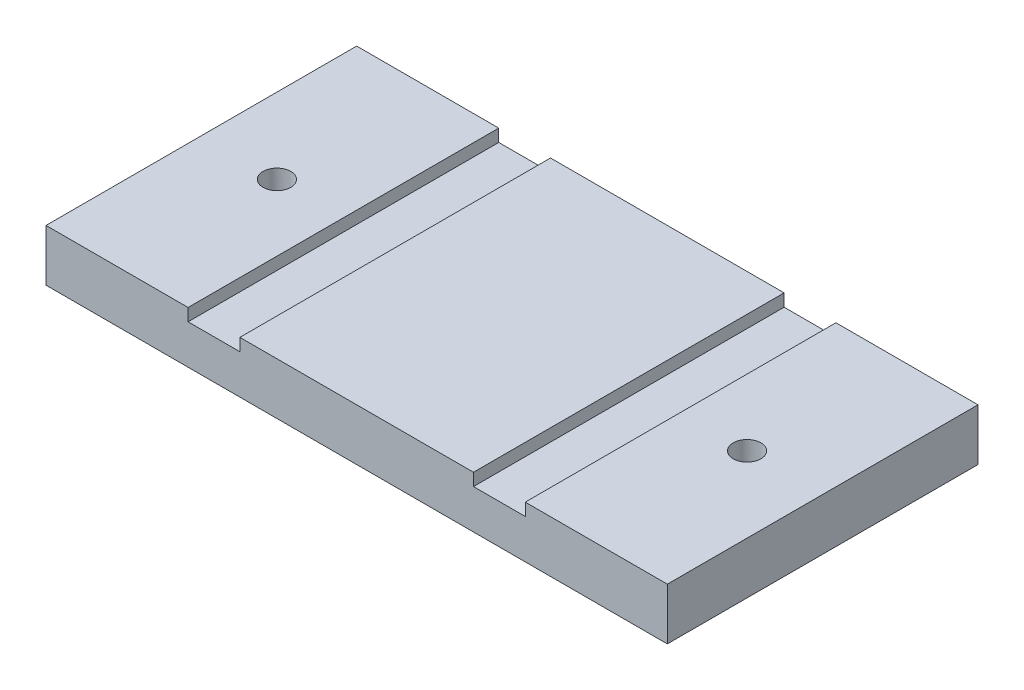
from build123d import *

# Parameters (mm, degrees)
SKETCH1_W            = 76.2
SKETCH1_H            = 38.1
BOSS_EXTRUDE1_DEPTH  = 6.35
M3_CLEARANCE_HOLE1_D = 3.4
SKETCH5_W            = 6.35
SKETCH5_H            = 1.524
CUT_EXTRUDE1_DEPTH   = 86.430512699


with BuildPart() as part:
    # Sketch1 → Boss-Extrude1 (new body)
    with BuildSketch(Plane(origin=(0, 0, 0), x_dir=(1, 0, 0), z_dir=(0, 1, 0))):
        with Locations((38.1, 19.05)):
            Rectangle(SKETCH1_W, SKETCH1_H)
    extrude(amount=BOSS_EXTRUDE1_DEPTH)

    # M3 Clearance Hole1 (through all)
    with Locations(Plane(origin=(0, 6.35, 0), x_dir=(1, 0, 0), z_dir=(0, 1, 0))):
        with Locations((9.271, 19.05), (66.929, 19.05)):
            Hole(M3_CLEARANCE_HOLE1_D / 2)

    # Sketch5 → Cut-Extrude1 (cut, through all)
    with BuildSketch(Plane.XY):
        with Locations((55.6, 5.588)):
            Rectangle(SKETCH5_W, SKETCH5_H)
        with Locations((20.6, 5.588)):
            Rectangle(SKETCH5_W, SKETCH5_H)
    extrude(amount=-CUT_EXTRUDE1_DEPTH, mode=Mode.SUBTRACT)


solid = part.part
